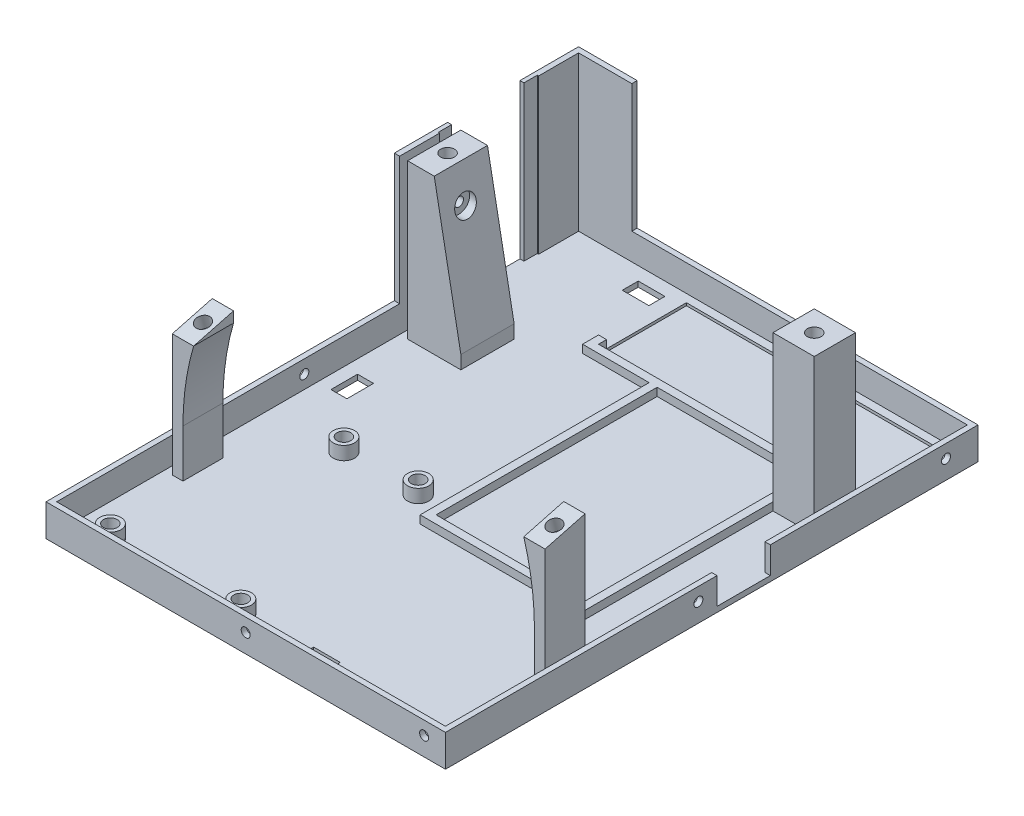
from build123d import *

# Parameters (mm, degrees)
SKETCH1_W                 = 150
SKETCH1_H                 = 200
BOSS_EXTRUDE1_DEPTH       = 2
SKETCH2_W                 = 6
SKETCH2_H                 = 10
SKETCH2_W_2               = 10
SKETCH2_H_2               = 6
CUT_EXTRUDE1_DEPTH        = 126.015998976
SKETCH5_W                 = 146
SKETCH5_H                 = 196
BOSS_EXTRUDE2_DEPTH       = 10
SKETCH6_W                 = 27.2
SKETCH6_H                 = 10
CUT_EXTRUDE2_DEPTH        = 10
SKETCH8_R                 = 1.7
CUT_EXTRUDE4_DEPTH        = 181.676506497
SKETCH10_W                = 20
SKETCH10_H                = 10
CUT_EXTRUDE6_DEPTH        = 10
SKETCH15_R                = 1.7
CUT_EXTRUDE7_DEPTH        = 10
SKETCH16_R                = 1.7
CUT_EXTRUDE8_DEPTH        = 3
SKETCH19_R                = 4
BOSS_EXTRUDE3_DEPTH       = 5
SKETCH20_R                = 2.6
CUT_EXTRUDE10_DEPTH       = 5
BOSS_EXTRUDE4_DEPTH       = 3
SKETCH22_W                = 2
SKETCH22_H                = 20
BOSS_EXTRUDE5_DEPTH       = 48
SKETCH25_W                = 0.5
SKETCH25_H                = 5
CUT_EXTRUDE13_DEPTH       = 58
SKETCH26_R                = 1.7
CUT_EXTRUDE15_DEPTH       = 5
SKETCH27_W                = 20
SKETCH27_H                = 20
BOSS_EXTRUDE6_DEPTH       = 5
BOSS_EXTRUDE7_DEPTH       = 20
SKETCH29_R                = 4
CUT_EXTRUDE16_DEPTH       = 10
SKETCH31_R                = 1.7
CUT_EXTRUDE17_DEPTH       = 179.395627749
BOSS_EXTRUDE9_DEPTH       = 3
SKETCH35_W                = 15.5
SKETCH35_H                = 15.5
BOSS_EXTRUDE10_DEPTH      = 58
SKETCH36_R                = 2.6
CUT_EXTRUDE20_DEPTH       = 5
SKETCH38_R                = 2.6
CUT_EXTRUDE21_DEPTH       = 5
SKETCH37_W                = 4
SKETCH37_H                = 15
BOSS_EXTRUDE11_DEPTH      = 45.92
BOSS_EXTRUDE12_DEPTH      = 4
BOSS_EXTRUDE12_DEPTH_BACK = 4
FILLET1_R                 = 100
BOSS_EXTRUDE13_DEPTH      = 8
FILLET2_R                 = 100
SKETCH41_R                = 2.6
CUT_EXTRUDE22_DEPTH       = 5
SKETCH42_W                = 99.5
SKETCH42_H                = 33
CUT_EXTRUDE23_DEPTH       = 1


with BuildPart() as part:
    # Sketch1 → Boss-Extrude1 (new body)
    with BuildSketch(Plane(origin=(0, 0, 0), x_dir=(1, 0, 0), z_dir=(0, 1, 0))):
        Rectangle(SKETCH1_W, SKETCH1_H)
    extrude(amount=BOSS_EXTRUDE1_DEPTH)

    # Sketch2 → Cut-Extrude1 (cut, through all)
    with BuildSketch(Plane(origin=(0, 2, 0), x_dir=(1, 0, 0), z_dir=(0, 1, 0))):
        with Locations((-65, 5)):
            Rectangle(SKETCH2_W, SKETCH2_H)
        with Locations((17.5, -90)):
            Rectangle(SKETCH2_W_2, SKETCH2_H_2)
        with Locations((-40.588652837, 90)):
            Rectangle(SKETCH2_W_2, SKETCH2_H_2)
    extrude(amount=-CUT_EXTRUDE1_DEPTH, mode=Mode.SUBTRACT)

    # Sketch5 → Boss-Extrude2 (add)
    with BuildSketch(Plane(origin=(0, 2, 0), x_dir=(1, 0, 0), z_dir=(0, 1, 0))):
        Polygon((-75, 100), (-75, -100), (75, -100), (75, -98), (75, 98), (75, 100), align=None)
        Rectangle(SKETCH5_W, SKETCH5_H, mode=Mode.SUBTRACT)
    extrude(amount=BOSS_EXTRUDE2_DEPTH)

    # Sketch6 → Cut-Extrude2 (cut)
    with BuildSketch(Plane.ZY.offset(75)):
        with Locations((-64.4, 7)):
            Rectangle(SKETCH6_W, SKETCH6_H)
    extrude(amount=-CUT_EXTRUDE2_DEPTH, mode=Mode.SUBTRACT)

    # Sketch8 → Cut-Extrude4 (cut, through all)
    with BuildSketch(Plane.ZY.offset(75)):
        with Locations((5, 7)):
            Circle(SKETCH8_R)
    extrude(amount=-CUT_EXTRUDE4_DEPTH, mode=Mode.SUBTRACT)

    # Sketch10 → Cut-Extrude6 (cut)
    with BuildSketch(Plane(origin=(75, 0, 0), x_dir=(0, 0, -1), z_dir=(1, 0, 0))):
        with Locations((12, 7)):
            Rectangle(SKETCH10_W, SKETCH10_H)
    extrude(amount=-CUT_EXTRUDE6_DEPTH, mode=Mode.SUBTRACT)

    # Sketch15 → Cut-Extrude7 (cut)
    with BuildSketch(Plane.XY.offset(100)):
        with Locations((0, 7)):
            Circle(SKETCH15_R)
    extrude(amount=-CUT_EXTRUDE7_DEPTH, mode=Mode.SUBTRACT)

    # Sketch16 → Cut-Extrude8 (cut)
    with BuildSketch(Plane.XY.offset(100)):
        with Locations((67, 7)):
            Circle(SKETCH16_R)
    extrude(amount=-CUT_EXTRUDE8_DEPTH, mode=Mode.SUBTRACT)

    # Sketch19 → Boss-Extrude3 (add)
    with BuildSketch(Plane(origin=(0, 2, 0), x_dir=(1, 0, 0), z_dir=(0, 1, 0))):
        with Locations(Location((-60.85, -90, 0), (0, 0, 270))):
            Circle(SKETCH19_R)
        with Locations(Location((-11.85, -90, 0), (0, 0, 270))):
            Circle(SKETCH19_R)
        with Locations(Location((-45.23, -17.9, 0), (0, 0, 270))):
            Circle(SKETCH19_R)
        with Locations(Location((-17.32, -17.9, 0), (0, 0, 270))):
            Circle(SKETCH19_R)
    extrude(amount=BOSS_EXTRUDE3_DEPTH)

    # Sketch20 → Cut-Extrude10 (cut)
    with BuildSketch(Plane(origin=(0, 7, 0), x_dir=(1, 0, 0), z_dir=(0, 1, 0))):
        with Locations(Location((-45.23, -17.9, 0), (0, 0, 270))):
            Circle(SKETCH20_R)
        with Locations(Location((-17.32, -17.9, 0), (0, 0, 270))):
            Circle(SKETCH20_R)
        with Locations(Location((-11.85, -90, 0), (0, 0, 270))):
            Circle(SKETCH20_R)
        with Locations(Location((-60.85, -90, 0), (0, 0, 270))):
            Circle(SKETCH20_R)
    extrude(amount=-CUT_EXTRUDE10_DEPTH, mode=Mode.SUBTRACT)

    # Sketch21 → Boss-Extrude4 (add)
    with BuildSketch(Plane(origin=(0, 2, 0), x_dir=(1, 0, 0), z_dir=(0, 1, 0))):
        Polygon((-29.5, 65), (-32.5, 65), (-32.5, 59), (70, 59), (70, 62), (-29.5, 62), align=None)
    extrude(amount=BOSS_EXTRUDE4_DEPTH)

    # Sketch22 → Boss-Extrude5 (add)
    with BuildSketch(Plane(origin=(0, 12, 0), x_dir=(1, 0, 0), z_dir=(0, 1, 0))):
        with Locations((-74, 40.8)):
            Rectangle(SKETCH22_W, SKETCH22_H)
        Polygon((-75, 100), (-53, 100), (-53, 98), (-73, 98), (-73, 78), (-75, 78), align=None)
    extrude(amount=BOSS_EXTRUDE5_DEPTH)

    # Sketch25 → Cut-Extrude13 (cut)
    with BuildSketch(Plane(origin=(0, 60, 0), x_dir=(1, 0, 0), z_dir=(0, 1, 0))):
        with Locations((-73.25, 80.5)):
            Rectangle(SKETCH25_W, SKETCH25_H)
        with Locations((-73.25, 48.3)):
            Rectangle(SKETCH25_W, SKETCH25_H)
    extrude(amount=-CUT_EXTRUDE13_DEPTH, mode=Mode.SUBTRACT)

    # Sketch26 → Cut-Extrude15 (cut)
    with BuildSketch(Plane(origin=(75, 0, 0), x_dir=(0, 0, -1), z_dir=(1, 0, 0))):
        with Locations((88, 7)):
            Circle(SKETCH26_R)
    extrude(amount=-CUT_EXTRUDE15_DEPTH, mode=Mode.SUBTRACT)

    # Sketch27 → Boss-Extrude6 (add)
    with BuildSketch(Plane(origin=(0, 2, 0), x_dir=(1, 0, 0), z_dir=(0, 1, 0))):
        with Locations((-60, 40.8)):
            Rectangle(SKETCH27_W, SKETCH27_H)
    extrude(amount=BOSS_EXTRUDE6_DEPTH)

    # Sketch28 → Boss-Extrude7 (add)
    with BuildSketch(Plane.XY.offset(-30.8)):
        Polygon((-70, 7), (-70, 60), (-60, 60), (-50, 7), align=None)
    extrude(amount=-BOSS_EXTRUDE7_DEPTH)

    # Sketch29 → Cut-Extrude16 (cut)
    with BuildSketch(Plane(origin=(-50, 0, 0), x_dir=(0, 0, -1), z_dir=(1, 0, 0))):
        with Locations((40.087803788, 47)):
            Circle(SKETCH29_R)
    extrude(amount=-CUT_EXTRUDE16_DEPTH, mode=Mode.SUBTRACT)

    # Sketch31 → Cut-Extrude17 (cut, through all)
    with BuildSketch(Plane(origin=(-60, 0, 0), x_dir=(0, 0, -1), z_dir=(1, 0, 0))):
        with Locations((40.087803788, 47)):
            Circle(SKETCH31_R)
    extrude(amount=-CUT_EXTRUDE17_DEPTH, mode=Mode.SUBTRACT)

    # Sketch34 → Boss-Extrude9 (add)
    with BuildSketch(Plane(origin=(0, 2, 0), x_dir=(1, 0, 0), z_dir=(0, 1, 0))):
        Polygon((-4.5, 59), (-4.5, -24), (51.5, -24), (51.5, 59), (54.5, 59), (54.5, -27), (-7.5, -27), (-7.5, 59), align=None)
    extrude(amount=BOSS_EXTRUDE9_DEPTH)

    # Sketch35 → Boss-Extrude10 (add)
    with BuildSketch(Plane(origin=(0, 2, 0), x_dir=(1, 0, 0), z_dir=(0, 1, 0))):
        with Locations((62.25, 51.25)):
            Rectangle(SKETCH35_W, SKETCH35_H)
    extrude(amount=BOSS_EXTRUDE10_DEPTH)

    # Sketch36 → Cut-Extrude20 (cut)
    with BuildSketch(Plane(origin=(0, 60, 0), x_dir=(1, 0, 0), z_dir=(0, 1, 0))):
        with Locations(Location((62.25, 51.25, 0), (0, 0, 270))):
            Circle(SKETCH36_R)
    extrude(amount=-CUT_EXTRUDE20_DEPTH, mode=Mode.SUBTRACT)

    # Sketch38 → Cut-Extrude21 (cut)
    with BuildSketch(Plane(origin=(0, 60, 0), x_dir=(1, 0, 0), z_dir=(0, 1, 0))):
        with Locations(Location((-65, 40.8, 0), (0, 0, 270))):
            Circle(SKETCH38_R)
    extrude(amount=-CUT_EXTRUDE21_DEPTH, mode=Mode.SUBTRACT)

    # Sketch37 → Boss-Extrude11 (add)
    with BuildSketch(Plane(origin=(0, 2, 0), x_dir=(1, 0, 0), z_dir=(0, 1, 0))):
        with Locations((-68, -50.073123899)):
            Rectangle(SKETCH37_W, SKETCH37_H)
        with Locations((68, -50.073123899)):
            Rectangle(SKETCH37_W, SKETCH37_H)
    extrude(amount=BOSS_EXTRUDE11_DEPTH)

    # Sketch39 → Boss-Extrude12 (add, two sides: drawn at the far end of the back side and taken through both)
    with BuildSketch(Plane(origin=(-66, 0, 0), x_dir=(0, 0, -1), z_dir=(1, 0, 0)).offset(-BOSS_EXTRUDE12_DEPTH_BACK)):
        Polygon((-57.573123899, 47.92), (-42.573123899, 47.92), (-42.573123899, 51.89), align=None)
    extrude(amount=BOSS_EXTRUDE12_DEPTH + BOSS_EXTRUDE12_DEPTH_BACK)

    # Fillet1
    # the kernel refuses this fillet: 100 mm, written as the material it adds along each edge
    with BuildSketch(Plane(origin=(-66, 47.92, 57.573123899), x_dir=(1, 0, 0), z_dir=(0, 0, -1))) as fillet1_piece_1_section:
        with BuildLine():
            CenterArc((100, 28), FILLET1_R, 180, 16.260204708)
            Line((0, 28), (-2, 28))
            Line((-2, 28), (-2, 0))
            Line((-2, 0), (0, -2))
            ThreePointArc((0, -2), (2, -2), (2.08, -0.56))
            Line((2.08, -0.56), (4, 0))
        make_face()
    fillet1_piece_1 = extrude(amount=15, mode=Mode.PRIVATE)
    fillet1_piece_1 = split(fillet1_piece_1, bisect_by=Plane(origin=(-66.078013707, 49.109205827, 53.07990289), z_dir=(0, -0.9667146052036466, -0.25585713217723216)), keep=Keep.TOP, mode=Mode.PRIVATE)
    add(fillet1_piece_1)

    # Sketch40 → Boss-Extrude13 (add)
    with BuildSketch(Plane(origin=(70, 0, 0), x_dir=(0, 0, -1), z_dir=(1, 0, 0))):
        Polygon((-42.573123899, 47.92), (-42.573123899, 51.89), (-57.573123899, 47.92), align=None)
    extrude(amount=-BOSS_EXTRUDE13_DEPTH)

    # Fillet2
    # the kernel refuses this fillet: 100 mm, written as the material it adds along each edge
    with BuildSketch(Plane(origin=(66, 47.92, 42.573123899), x_dir=(-1, 0, 0), z_dir=(0, 0, 1))) as fillet2_piece_1_section:
        with BuildLine():
            CenterArc((100, 28), FILLET2_R, 180, 16.260204708)
            Line((0, 28), (-2, 28))
            Line((-2, 28), (-2, 0))
            Line((-2, 0), (0, -2))
            ThreePointArc((0, -2), (2, -2), (2.08, -0.56))
            Line((2.08, -0.56), (4, 0))
        make_face()
    fillet2_piece_1 = extrude(amount=15, mode=Mode.PRIVATE)
    fillet2_piece_1 = split(fillet2_piece_1, bisect_by=Plane(origin=(66.078013707, 49.109205827, 53.07990289), z_dir=(0, -0.9667146052036466, -0.25585713217723216)), keep=Keep.TOP, mode=Mode.PRIVATE)
    add(fillet2_piece_1)

    # Sketch41 → Cut-Extrude22 (cut)
    with BuildSketch(Plane(origin=(0, 59.02320322, 15.621474452), x_dir=(1, 0, 0), z_dir=(0, 0.9667146052036468, 0.2558571321772319))):
        with Locations(Location((-66, -35.63787002, 0), (0, 0, 270))):
            Circle(SKETCH41_R)
        with Locations(Location((66, -35.63787002, 0), (0, 0, 270))):
            Circle(SKETCH41_R)
    extrude(amount=-CUT_EXTRUDE22_DEPTH, mode=Mode.SUBTRACT)

    # Sketch42 → Cut-Extrude23 (cut)
    with BuildSketch(Plane(origin=(0, 2, 0), x_dir=(1, 0, 0), z_dir=(0, 1, 0))):
        with Locations((20.25, 78.5)):
            Rectangle(SKETCH42_W, SKETCH42_H)
    extrude(amount=-CUT_EXTRUDE23_DEPTH, mode=Mode.SUBTRACT)


solid = part.part
